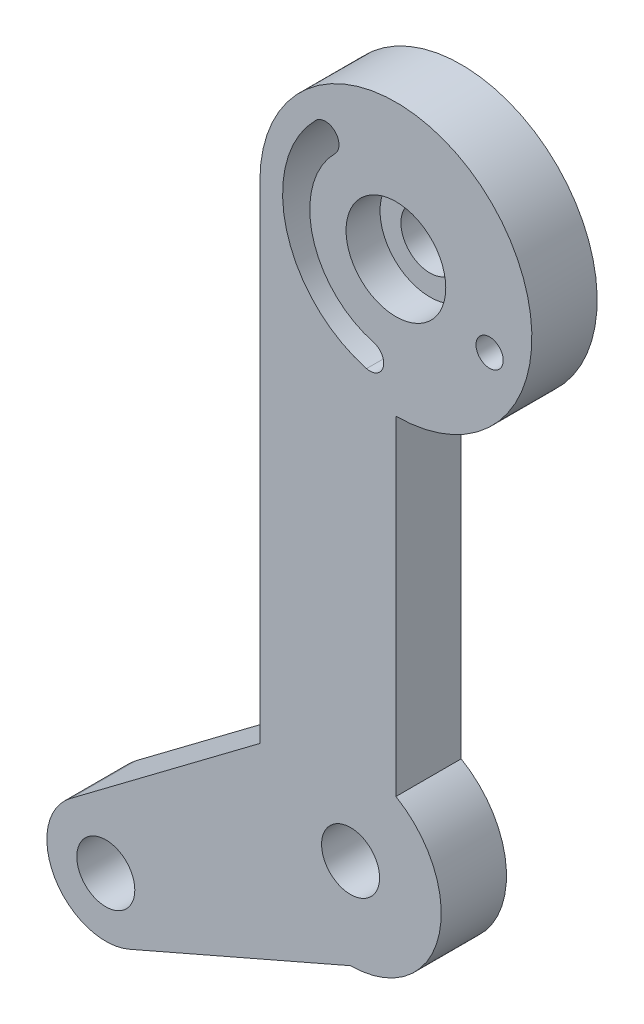
from build123d import *

# Parameters (mm, degrees)
SKETCH1_R           = 1.6
BOSS_EXTRUDE1_DEPTH = 3.6
SKETCH2_R           = 0.75
CUT_EXTRUDE1_DEPTH  = 42.228297321
SKETCH4_R           = 2.75
CUT_EXTRUDE3_DEPTH  = 1.875


with BuildPart() as part:
    # Sketch1 → Boss-Extrude1 (new body)
    with BuildSketch(Plane.XY):
        with BuildLine():
            Line((-5, 30), (-5, 3.117408991))
            Line((-5, 3.117408991), (-15.45246273, -4.737424277))
            ThreePointArc((-15.45246273, -4.737424277), (-16.30801025, -8.97190619), (-12.202106424, -10.31516804))
            Line((-12.202106424, -10.31516804), (0, -5))
            ThreePointArc((0, -5), (4.829629131, -1.294095226), (2.5, 4.330127019))
            Line((2.5, 4.330127019), (2.5, 22.5))
            ThreePointArc((2.5, 22.5), (7.803300859, 35.303300859), (-5, 30))
        make_face()
        Circle(SKETCH1_R, mode=Mode.SUBTRACT)
        with Locations((-13.5, -7.335575406)):
            Circle(SKETCH1_R, mode=Mode.SUBTRACT)
        with Locations((2.5, 30)):
            Circle(SKETCH1_R, mode=Mode.SUBTRACT)
    extrude(amount=BOSS_EXTRUDE1_DEPTH)

    # Sketch2 → Cut-Extrude1 (cut, through all)
    with BuildSketch(Plane.XY.offset(3.6)):
        with Locations((7.668309414, 28.118889212)):
            Circle(SKETCH2_R)
        with BuildLine():
            ThreePointArc((-0.858757211, 33.358757211), (-0.858757211, 34.419417382), (-1.919417382, 34.419417382))
            ThreePointArc((-1.919417382, 34.419417382), (-3.537036414, 28.382380968), (0.882380968, 23.962963586))
            ThreePointArc((0.882380968, 23.962963586), (1.800939622, 24.493293672), (1.270609536, 25.411852325))
            ThreePointArc((1.270609536, 25.411852325), (-2.088147675, 28.770609536), (-0.858757211, 33.358757211))
        make_face()
    extrude(amount=-CUT_EXTRUDE1_DEPTH, mode=Mode.SUBTRACT)

    # Sketch4 → Cut-Extrude3 (cut)
    with BuildSketch(Plane.XY.offset(3.6)):
        with Locations((2.5, 30)):
            Circle(SKETCH4_R)
    extrude(amount=-CUT_EXTRUDE3_DEPTH, mode=Mode.SUBTRACT)


solid = part.part
